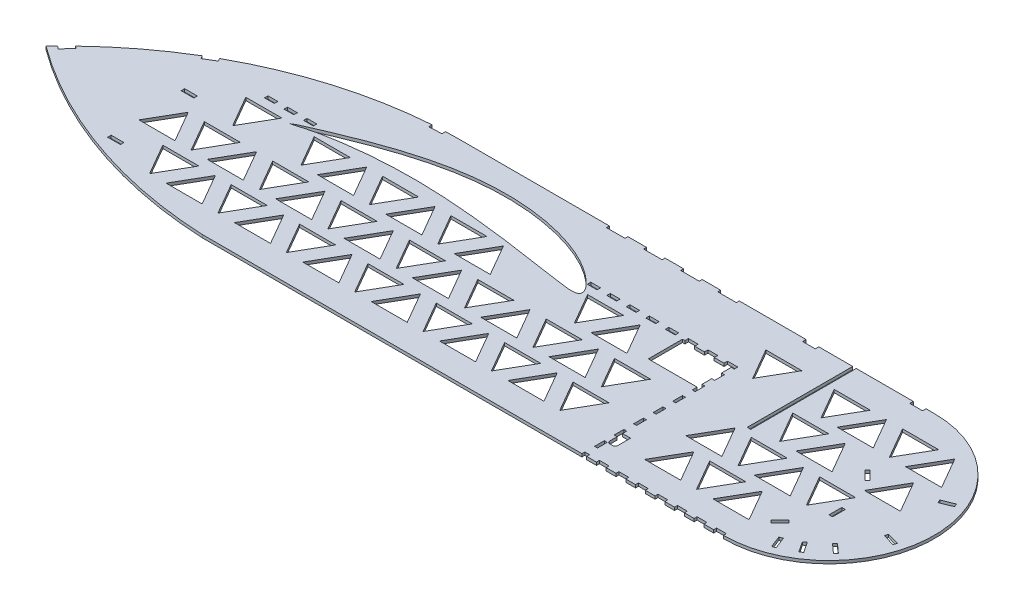
from build123d import *

# Parameters (mm, degrees)
BOSS_EXTRUDE1_DEPTH = 3
SKETCH2_W           = 3.6
SKETCH2_H           = 13
SKETCH2_W_2         = 13
SKETCH2_H_2         = 3.6
SKETCH2_W_3         = 19
SKETCH2_H_3         = 3
SKETCH2_W_4         = 10
SKETCH2_W_5         = 3
SKETCH2_H_4         = 10
SKETCH2_W_6         = 4.93
SKETCH2_H_5         = 108
CUT_EXTRUDE1_DEPTH  = 934.342916617


with BuildPart() as part:
    # Sketch1 → Boss-Extrude1 (new body)
    with BuildSketch(Plane(origin=(0, 0, 0), x_dir=(1, 0, 0), z_dir=(0, 1, 0))):
        with BuildLine():
            Line((266.408252791, 0), (800, 0))
            ThreePointArc((800, 0), (908, 108), (800, 216))
            Line((800, 216), (316.294556964, 216))
            ThreePointArc((316.294556964, 216), (154.432198565, 182.326352039), (19.429068043, 86.893169221))
            ThreePointArc((19.429068043, 86.893169221), (136.475600537, 25.133273094), (266.408252791, 0))
        make_face()
    extrude(amount=BOSS_EXTRUDE1_DEPTH)

    # Sketch2 → Cut-Extrude1 (cut, through all)
    with BuildSketch(Plane.XZ):
        Polygon((647.57, -153), (637.57, -153), (637.57, -156.6), (627.57, -156.6), (627.57, -153), (617.57, -153), (617.57, -156.6), (607.57, -156.6), (607.57, -153), (605.07, -153), (605.07, -118), (655.07, -118), (655.07, -113), (658.07, -113), (658.07, -123), (655.07, -123), (655.07, -133), (658.07, -133), (658.07, -143), (655.07, -143), (655.07, -153), (658.07, -153), (658.07, -156.6), (647.57, -156.6), align=None)
        Polygon((823.689305433, -121.232773417), (814.496917278, -130.425161573), (817.04250169, -132.970745985), (826.234889846, -123.77835783), align=None)
        Polygon((833.216286063, -28.127768374), (837.957262065, -16.0230938), (834.605198337, -14.710208137), (829.864222335, -26.814882712), align=None)
        with Locations((837.65655194, -78.816857664)):
            Rectangle(SKETCH2_W, SKETCH2_H)
        with BuildLine():
            Line((658.07, -25.473381029), (658.07, -33))
            Line((658.07, -33), (655.07, -33))
            Line((655.07, -33), (655.07, -43))
            Line((655.07, -43), (658.07, -43))
            Line((658.07, -43), (658.07, -38.673381029))
            Line((658.07, -38.673381029), (666.27, -38.673381029))
            Line((666.27, -38.673381029), (666.27, -25.473381029))
            ThreePointArc((666.27, -25.473381029), (665.537766953, -23.705614076), (663.77, -22.973381029))
            Line((663.77, -22.973381029), (660.57, -22.973381029))
            ThreePointArc((660.57, -22.973381029), (658.802233047, -23.705614076), (658.07, -25.473381029))
        make_face()
        with BuildLine():
            Line((212.57, -142.861782597), (212.57, -142.894782597))
            add(Edge.make_bspline(
                [(212.57, -142.894782597), (212.815137814, -143.060102486), (213.721483955, -143.671338431), (215.664179604, -144.820627165), (218.723437449, -146.377902142), (222.783765044, -148.180430449), (227.75908382, -150.380753256), (233.673151887, -152.972942719), (243.334631626, -157.073964415), (254.071597155, -161.528560196), (265.811315632, -166.151386352), (275.559769605, -169.792616013), (285.820264156, -173.389650289), (300.213165162, -178.042893994), (315.047470761, -182.21442891), (330.216772764, -185.678244178), (341.716798025, -187.862793988), (353.238408154, -189.570546018), (364.74982071, -190.789827969), (376.222154657, -191.489317525), (387.611451467, -191.686885836), (398.853751386, -191.364655348), (413.421420996, -190.296341642), (427.580802498, -188.300042396), (441.195366572, -185.427458978), (450.821943115, -182.919735681), (459.948918056, -180.069695278), (468.511745548, -176.887644359), (476.453624938, -173.424739179), (483.715148146, -169.728859345), (490.24814377, -165.884833696), (496.019667562, -162.00694583), (500.998027396, -158.185747413), (505.147593549, -154.484087589), (508.447339472, -150.982728864), (510.852240131, -147.780842115), (512.23052565, -145.118995071), (512.672376723, -143.038033672), (512.365957104, -141.293980261), (510.836297954, -139.867947677), (508.300825673, -139.204557497), (504.990749494, -138.996901122), (500.845143819, -139.232879923), (495.886387834, -139.807005807), (490.127383335, -140.633765729), (483.600688534, -141.61415409), (476.345974836, -142.681971784), (468.41886468, -143.870863791), (459.86962452, -145.152957933), (447.40415706, -147.014008038), (434.302787697, -148.89198326), (413.230560269, -151.680307043), (394.916461571, -153.770522792), (372.413070638, -155.785169178), (353.278576878, -157.097400442), (334.10390548, -157.72050793), (318.83753012, -157.719300437), (307.569298967, -157.463067348), (296.54483902, -156.942386113), (285.853643217, -156.19861473), (275.586288909, -155.254588864), (265.829573747, -154.156930461), (256.673464041, -152.912824912), (248.205041684, -151.55854436), (240.510067524, -150.123302558), (233.666056009, -148.664077742), (227.735558734, -147.229571507), (222.771530443, -145.80558608), (218.774640723, -144.512633605), (215.724793866, -143.595242016), (213.753356987, -143.096728121), (212.816237246, -142.910670921), (212.57, -142.861782597)],
                knots=[0, 0, 0, 0, 0.001413477, 0.005226038, 0.010781091, 0.017815608, 0.026460951, 0.036790889, 0.048685593, 0.076639155, 0.092362872, 0.109003461, 0.126386903, 0.144339126, 0.181312719, 0.200023431, 0.218712626, 0.237261299, 0.255692478, 0.274037197, 0.292192583, 0.310132767, 0.327788163, 0.362001934, 0.378421226, 0.394286639, 0.40954344, 0.424114253, 0.43793778, 0.450941833, 0.463044023, 0.474154417, 0.484164575, 0.493023962, 0.500713088, 0.507125739, 0.512129705, 0.514904185, 0.517171427, 0.520261618, 0.5242453, 0.529497961, 0.536092185, 0.54406114, 0.553363127, 0.563904543, 0.575614949, 0.588420092, 0.60222661, 0.616944448, 0.648675826, 0.665501113, 0.718564132, 0.736789145, 0.773513212, 0.810244924, 0.828488569, 0.846493195, 0.864125178, 0.88124851, 0.897725282, 0.913415058, 0.928184346, 0.941897285, 0.954411455, 0.965602702, 0.975349728, 0.983575522, 0.990284579, 0.99543259, 0.998799869, 1, 1, 1, 1], degree=3))
        make_face()
        with Locations((134.542485822, -118.459135811)):
            Rectangle(SKETCH2_W_2, SKETCH2_H_2)
        with Locations((138.193962825, -39.604200299)):
            Rectangle(SKETCH2_W_2, SKETCH2_H_2)
        Polygon((237.285906423, -101.160362438), (274.226762414, -101.160362438), (255.756334419, -69.168642712), align=None)
        Polygon((879.46612068, -142.176464253), (891.512779688, -147.062976991), (892.865967831, -143.726979112), (880.819308823, -138.840466374), align=None)
        Polygon((883.56409693, -85.640734603), (896.049682188, -82.019939003), (895.047000329, -78.562392317), (882.561415072, -82.183187916), align=None)
        Polygon((865.40073975, -51.381643569), (875.050147879, -42.670218728), (872.637753308, -39.998074939), (862.988345179, -48.709499779), align=None)
        Polygon((849.114653162, -36.791532178), (856.271451565, -25.938871831), (853.266099469, -23.956989196), (846.109301065, -34.809649543), align=None)
        Polygon((822.408918344, -44.734564455), (813.216530188, -35.542176299), (810.670945776, -38.087760711), (819.863333931, -47.280148867), align=None)
        with Locations((785, -214.2)):
            Rectangle(SKETCH2_W_2, SKETCH2_H_2)
        with Locations((675.107627624, -214.2)):
            Rectangle(SKETCH2_W_2, SKETCH2_H_2)
        with Locations((590.701810534, -214.5)):
            Rectangle(SKETCH2_W_3, SKETCH2_H_3)
        with Locations((552.701810534, -214.5)):
            Rectangle(SKETCH2_W_3, SKETCH2_H_3)
        with Locations((514.701810534, -214.5)):
            Rectangle(SKETCH2_W_3, SKETCH2_H_3)
        with Locations((476.701810534, -214.5)):
            Rectangle(SKETCH2_W_3, SKETCH2_H_3)
        Polygon((286.653605669, -215.067910052), (299.639993398, -215.662665262), (299.804694841, -212.066434814), (286.818307112, -211.471679604), align=None)
        Polygon((107.891846949, -158.40758228), (119.051202256, -165.076074548), (120.897861653, -161.98579154), (109.738506346, -155.317299272), align=None)
        Polygon((25.225136805, -93.110530953), (34.089712558, -102.619437132), (36.722948115, -100.164631538), (27.858372362, -90.65572536), align=None)
        with Locations((532.57, -154.8)):
            Rectangle(SKETCH2_W_4, SKETCH2_H_2)
        with Locations((552.57, -154.8)):
            Rectangle(SKETCH2_W_4, SKETCH2_H_2)
        with Locations((572.57, -154.8)):
            Rectangle(SKETCH2_W_4, SKETCH2_H_2)
        with Locations((592.57, -154.8)):
            Rectangle(SKETCH2_W_4, SKETCH2_H_2)
        with Locations((656.57, -98)):
            Rectangle(SKETCH2_W_5, SKETCH2_H_4)
        with Locations((656.57, -78)):
            Rectangle(SKETCH2_W_5, SKETCH2_H_4)
        with Locations((656.57, -58)):
            Rectangle(SKETCH2_W_5, SKETCH2_H_4)
        with Locations((656.57, -18)):
            Rectangle(SKETCH2_W_5, SKETCH2_H_4)
        with Locations((657.535, -1.5)):
            Rectangle(SKETCH2_W_6, SKETCH2_H_3)
        with Locations((675, -1.5)):
            Rectangle(SKETCH2_W_4, SKETCH2_H_3)
        with Locations((695, -1.5)):
            Rectangle(SKETCH2_W_4, SKETCH2_H_3)
        with Locations((715, -1.5)):
            Rectangle(SKETCH2_W_4, SKETCH2_H_3)
        with Locations((735, -1.5)):
            Rectangle(SKETCH2_W_4, SKETCH2_H_3)
        with Locations((755, -1.5)):
            Rectangle(SKETCH2_W_4, SKETCH2_H_3)
        with Locations((775, -1.5)):
            Rectangle(SKETCH2_W_4, SKETCH2_H_3)
        with Locations((795, -1.5)):
            Rectangle(SKETCH2_W_4, SKETCH2_H_3)
        Polygon((202.285906423, -69.168642712), (239.226762414, -69.168642712), (220.756334419, -101.160362438), align=None)
        with Locations((182.07, -154.8)):
            Rectangle(SKETCH2_W_4, SKETCH2_H_2)
        with Locations((202.07, -154.8)):
            Rectangle(SKETCH2_W_4, SKETCH2_H_2)
        with Locations((222.07, -154.8)):
            Rectangle(SKETCH2_W_4, SKETCH2_H_2)
        with Locations((512.57, -154.8)):
            Rectangle(SKETCH2_W_4, SKETCH2_H_2)
        Polygon((202.285906423, -26.990109245), (239.226762414, -26.990109245), (220.756334419, -58.981828971), align=None)
        Polygon((132.285906423, -69.168642712), (169.226762414, -69.168642712), (150.756334419, -101.160362438), align=None)
        Polygon((167.285906423, -101.160362438), (204.226762414, -101.160362438), (185.756334419, -69.168642712), align=None)
        Polygon((166.955188323, -58.981828971), (203.896044314, -58.981828971), (185.425616319, -26.990109245), align=None)
        Polygon((236.955188323, -58.981828971), (273.896044314, -58.981828971), (255.425616319, -26.990109245), align=None)
        with Locations((718.2, -162)):
            Rectangle(SKETCH2_W, SKETCH2_H_5)
        Polygon((307.285906423, -101.160362438), (344.226762414, -101.160362438), (325.756334419, -69.168642712), align=None)
        Polygon((272.285906423, -69.168642712), (309.226762414, -69.168642712), (290.756334419, -101.160362438), align=None)
        Polygon((272.285906423, -26.990109245), (309.226762414, -26.990109245), (290.756334419, -58.981828971), align=None)
        Polygon((306.955188323, -58.981828971), (343.896044314, -58.981828971), (325.425616319, -26.990109245), align=None)
        Polygon((377.285906423, -101.160362438), (414.226762414, -101.160362438), (395.756334419, -69.168642712), align=None)
        Polygon((342.285906423, -69.168642712), (379.226762414, -69.168642712), (360.756334419, -101.160362438), align=None)
        Polygon((342.285906423, -26.990109245), (379.226762414, -26.990109245), (360.756334419, -58.981828971), align=None)
        Polygon((376.955188323, -58.981828971), (413.896044314, -58.981828971), (395.425616319, -26.990109245), align=None)
        Polygon((447.285906423, -101.160362438), (484.226762414, -101.160362438), (465.756334419, -69.168642712), align=None)
        Polygon((412.285906423, -69.168642712), (449.226762414, -69.168642712), (430.756334419, -101.160362438), align=None)
        Polygon((412.285906423, -26.990109245), (449.226762414, -26.990109245), (430.756334419, -58.981828971), align=None)
        Polygon((446.955188323, -58.981828971), (483.896044314, -58.981828971), (465.425616319, -26.990109245), align=None)
        Polygon((517.285906423, -101.160362438), (554.226762414, -101.160362438), (535.756334419, -69.168642712), align=None)
        Polygon((482.285906423, -69.168642712), (519.226762414, -69.168642712), (500.756334419, -101.160362438), align=None)
        Polygon((482.285906423, -26.990109245), (519.226762414, -26.990109245), (500.756334419, -58.981828971), align=None)
        Polygon((516.955188323, -58.981828971), (553.896044314, -58.981828971), (535.425616319, -26.990109245), align=None)
        Polygon((587.285906423, -101.160362438), (624.226762414, -101.160362438), (605.756334419, -69.168642712), align=None)
        Polygon((552.285906423, -69.168642712), (589.226762414, -69.168642712), (570.756334419, -101.160362438), align=None)
        Polygon((552.285906423, -26.990109245), (589.226762414, -26.990109245), (570.756334419, -58.981828971), align=None)
        Polygon((586.955188323, -58.981828971), (623.896044314, -58.981828971), (605.425616319, -26.990109245), align=None)
        Polygon((727.285906423, -101.160362438), (764.226762414, -101.160362438), (745.756334419, -69.168642712), align=None)
        Polygon((692.285906423, -69.168642712), (729.226762414, -69.168642712), (710.756334419, -101.160362438), align=None)
        Polygon((692.285906423, -26.990109245), (729.226762414, -26.990109245), (710.756334419, -58.981828971), align=None)
        Polygon((726.955188323, -58.981828971), (763.896044314, -58.981828971), (745.425616319, -26.990109245), align=None)
        Polygon((797.285906423, -101.160362438), (834.226762414, -101.160362438), (815.756334419, -69.168642712), align=None)
        Polygon((762.285906423, -69.168642712), (799.226762414, -69.168642712), (780.756334419, -101.160362438), align=None)
        Polygon((762.285906423, -26.990109245), (799.226762414, -26.990109245), (780.756334419, -58.981828971), align=None)
        Polygon((236.955188323, -143.981828971), (273.896044314, -143.981828971), (255.425616319, -111.990109245), align=None)
        Polygon((272.285906423, -111.990109245), (309.226762414, -111.990109245), (290.756334419, -143.981828971), align=None)
        Polygon((306.955188323, -143.981828971), (343.896044314, -143.981828971), (325.425616319, -111.990109245), align=None)
        Polygon((342.285906423, -111.990109245), (379.226762414, -111.990109245), (360.756334419, -143.981828971), align=None)
        Polygon((376.955188323, -143.981828971), (413.896044314, -143.981828971), (395.425616319, -111.990109245), align=None)
        Polygon((412.285906423, -111.990109245), (449.226762414, -111.990109245), (430.756334419, -143.981828971), align=None)
        Polygon((516.955188323, -143.981828971), (553.896044314, -143.981828971), (535.425616319, -111.990109245), align=None)
        Polygon((552.285906423, -111.990109245), (589.226762414, -111.990109245), (570.756334419, -143.981828971), align=None)
        Polygon((657.285906423, -186.160362438), (694.226762414, -186.160362438), (675.756334419, -154.168642712), align=None)
        Polygon((727.285906423, -186.160362438), (764.226762414, -186.160362438), (745.756334419, -154.168642712), align=None)
        Polygon((726.955188323, -143.981828971), (763.896044314, -143.981828971), (745.425616319, -111.990109245), align=None)
        Polygon((797.285906423, -186.160362438), (834.226762414, -186.160362438), (815.756334419, -154.168642712), align=None)
        Polygon((762.285906423, -154.168642712), (799.226762414, -154.168642712), (780.756334419, -186.160362438), align=None)
        Polygon((762.285906423, -111.990109245), (799.226762414, -111.990109245), (780.756334419, -143.981828971), align=None)
        Polygon((832.285906423, -154.168642712), (869.226762414, -154.168642712), (850.756334419, -186.160362438), align=None)
        Polygon((832.285906423, -111.990109245), (869.226762414, -111.990109245), (850.756334419, -143.981828971), align=None)
        Polygon((166.955188323, -143.981828971), (203.896044314, -143.981828971), (185.425616319, -111.990109245), align=None)
    extrude(amount=-CUT_EXTRUDE1_DEPTH, mode=Mode.SUBTRACT)


solid = part.part
